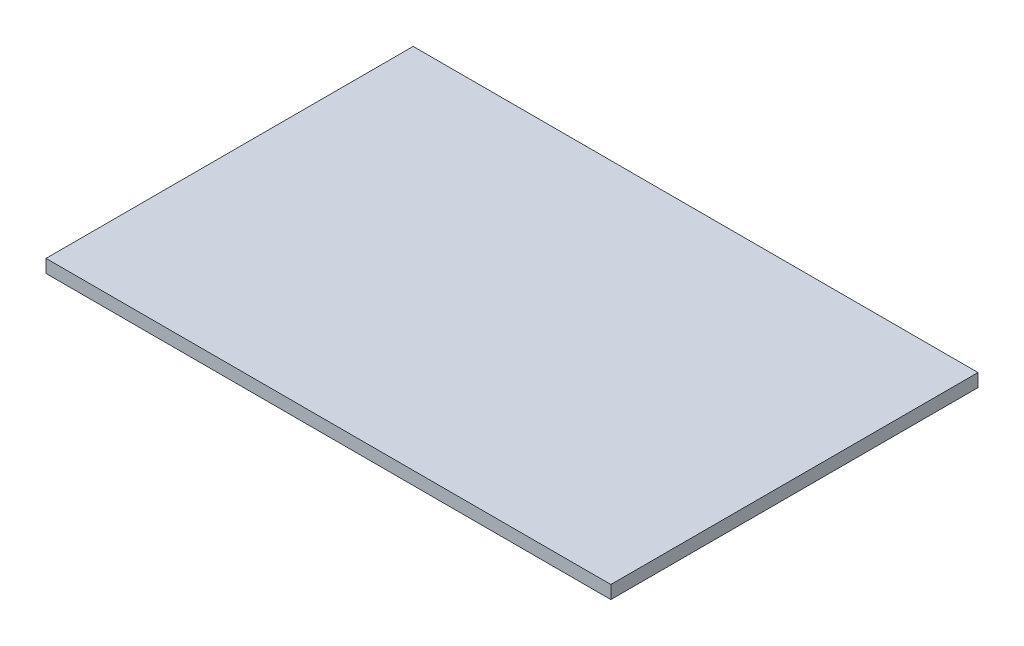
from build123d import *

# Parameters (mm, degrees)
SKETCH1_W          = 31.75
SKETCH1_H          = 20.6375
BASE_FLANGE1_DEPTH = 0.7366


# Sheet-metal steps are written as plain solids
with BuildPart() as part:
    # Sketch1 → Base-Flange1 (new body)
    with BuildSketch(Plane(origin=(0, 0, 0), x_dir=(1, 0, 0), z_dir=(0, 1, 0))):
        with Locations((15.875, 10.31875)):
            Rectangle(SKETCH1_W, SKETCH1_H)
    extrude(amount=-BASE_FLANGE1_DEPTH)


solid = part.part
